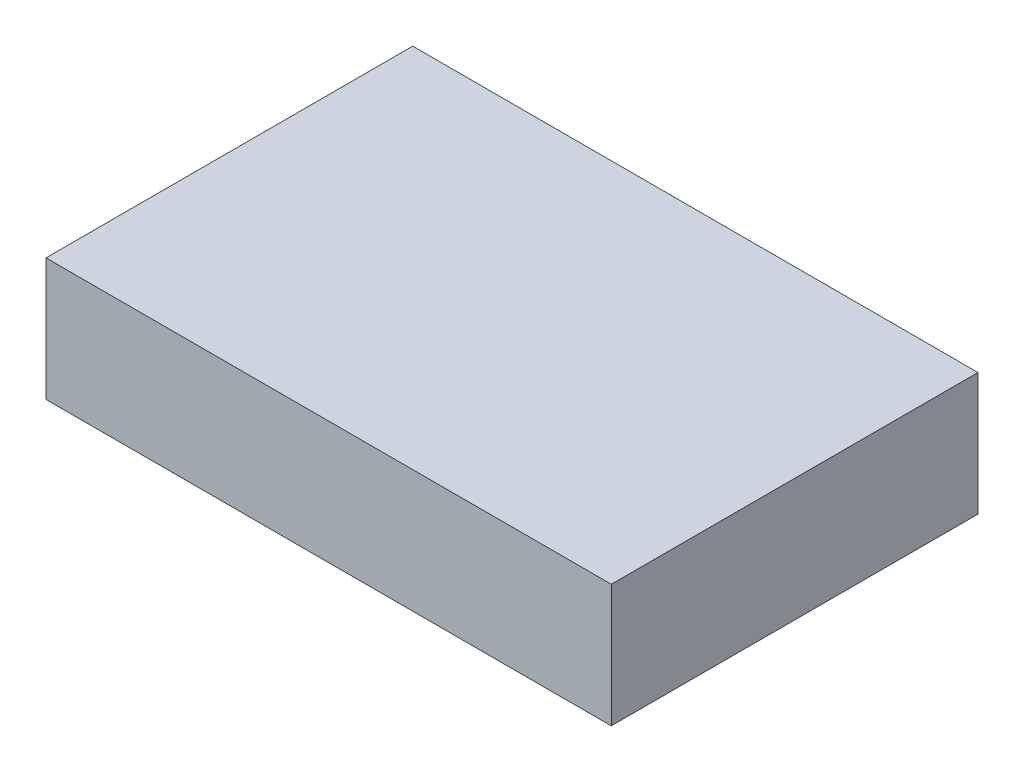
from build123d import *

# Parameters (mm, degrees)
SKETCH1_W           = 614.68
SKETCH1_H           = 398.78
BOSS_EXTRUDE2_DEPTH = 133.35


with BuildPart() as part:
    # Sketch1 → Boss-Extrude2 (new body)
    with BuildSketch(Plane(origin=(0, 0, 0), x_dir=(1, 0, 0), z_dir=(0, 1, 0))):
        with Locations((324.04, 143.867716774)):
            Rectangle(SKETCH1_W, SKETCH1_H)
    extrude(amount=BOSS_EXTRUDE2_DEPTH)


solid = part.part
